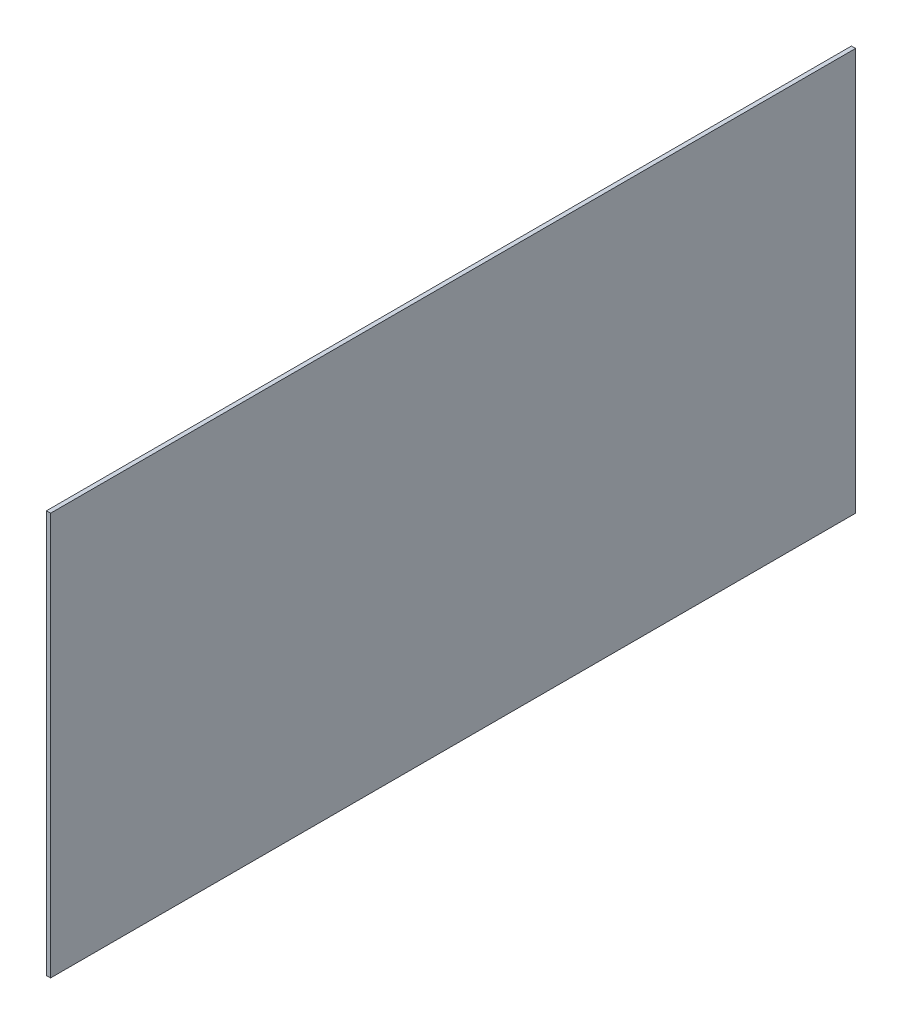
from build123d import *

# Parameters (mm, degrees)
SKETCH1_W           = 580
SKETCH1_H           = 290
BOSS_EXTRUDE1_DEPTH = 3


with BuildPart() as part:
    # Sketch1 → Boss-Extrude1 (new body)
    with BuildSketch(Plane(origin=(0, 0, 0), x_dir=(0, 0, -1), z_dir=(1, 0, 0))):
        with Locations((156.039387309, -120.960979477)):
            Rectangle(SKETCH1_W, SKETCH1_H)
    extrude(amount=BOSS_EXTRUDE1_DEPTH)


solid = part.part
